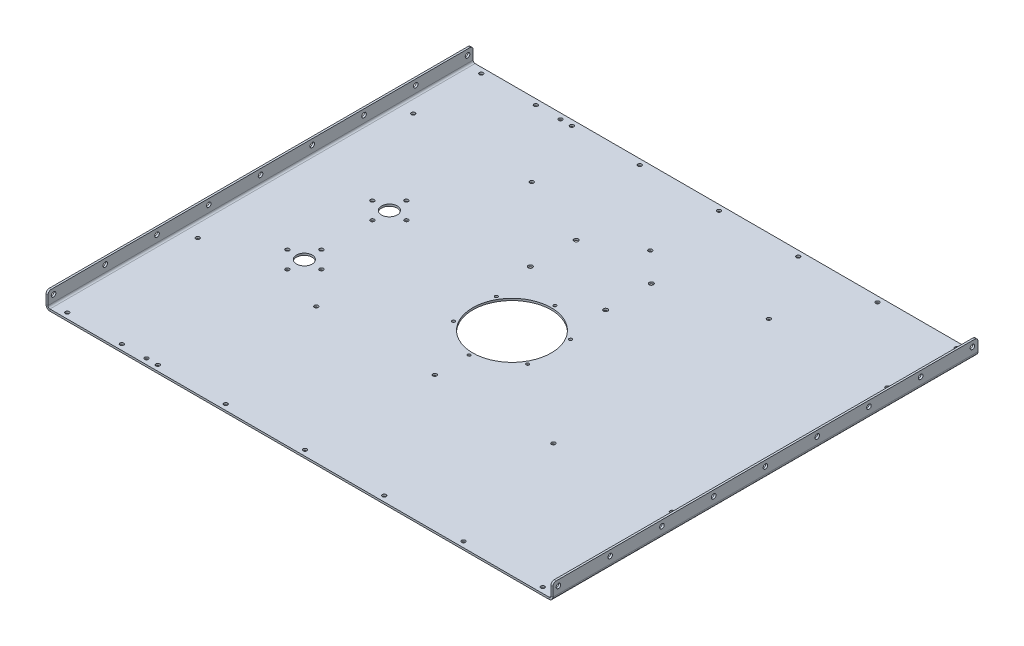
from build123d import *

# Parameters (mm, degrees)
BASE_FLANGE1_DEPTH       = 325
F_7_0_7_DIAMETER_HOLE1_D = 7
M5_CLEARANCE_HOLE1_D     = 5.8
SKETCH6_R                = 60
CUT_EXTRUDE1_DEPTH       = 3
M4_CLEARANCE_HOLE1_D     = 4.5
M6_CLEARANCE_HOLE1_D     = 6.6
M5_CLEARANCE_HOLE4_D     = 5.8
SKETCH13_R               = 12
CUT_EXTRUDE2_DEPTH       = 3
M5_CLEARANCE_HOLE2_D     = 5.8
M5_CLEARANCE_HOLE3_D     = 5.8
FILLET1_R                = 5


# Sheet-metal steps are written as plain solids
with BuildPart() as part:
    # Base-Flange1: sheet metal written as solids
    # Sketch1 → Base-Flange1 (new, symmetric)
    with BuildSketch(Plane.XY):
        with BuildLine():
            Line((-387.5, 25), (-387.5, 6))
            ThreePointArc((-387.5, 6), (-385.742640687, 1.757359313), (-381.5, 0))
            Line((-381.5, 0), (381.5, 0))
            ThreePointArc((381.5, 0), (385.742640687, 1.757359313), (387.5, 6))
            Line((387.5, 6), (387.5, 25))
            Line((387.5, 25), (384.5, 25))
            Line((384.5, 25), (384.5, 6))
            ThreePointArc((384.5, 6), (383.621320344, 3.878679656), (381.5, 3))
            Line((381.5, 3), (-381.5, 3))
            ThreePointArc((-381.5, 3), (-383.621320344, 3.878679656), (-384.5, 6))
            Line((-384.5, 6), (-384.5, 25))
            Line((-384.5, 25), (-387.5, 25))
        make_face()
    extrude(amount=BASE_FLANGE1_DEPTH, both=True)

    # Ø7.0 (7) Diameter Hole1 (through all)
    with Locations(Plane(origin=(387.5, 0, 0), x_dir=(0, 0, -1), z_dir=(1, 0, 0))):
        with Locations((-316.5, 16.5), (-237.375, 16.5), (-158.25, 16.5), (-79.125, 16.5), (0, 16.5), (79.125, 16.5), (158.25, 16.5), (237.375, 16.5), (316.5, 16.5)):
            Hole(F_7_0_7_DIAMETER_HOLE1_D / 2)

    # M5 Clearance Hole1 (through all)
    with Locations(Plane(origin=(0, 0, 0), x_dir=(-1, 0, 0), z_dir=(0, -1, 0))):
        with Locations((-363.5, 316.5), (-242.333333333, 316.5), (-121.166666667, 316.5), (0, 316.5), (121.166666667, 316.5), (242.333333333, 316.5), (363.5, 316.5)):
            m5_clearance_hole1 = Hole(M5_CLEARANCE_HOLE1_D / 2)

    # Mirror1: M5 Clearance Hole1 across plane
    add(m5_clearance_hole1.mirror(Plane.XY), mode=Mode.SUBTRACT)

    # Sketch6 → Cut-Extrude1 (cut)
    with BuildSketch(Plane(origin=(0, 3, 0), x_dir=(1, 0, 0), z_dir=(0, 1, 0))):
        with Locations(Location((0, 0, 0), (0, 0, 270))):
            Circle(SKETCH6_R)
    extrude(amount=-CUT_EXTRUDE1_DEPTH, mode=Mode.SUBTRACT)

    # M4 Clearance Hole1 (through all)
    with Locations(Plane(origin=(0, 3, 0), x_dir=(1, 0, 0), z_dir=(0, 1, 0))):
        with Locations((0, -65.5), (-56.724663948, -32.75), (-56.724663948, 32.75), (0, 65.5), (56.724663948, 32.75), (56.724663948, -32.75)):
            Hole(M4_CLEARANCE_HOLE1_D / 2)

    # M6 Clearance Hole1 (through all)
    with Locations(Plane(origin=(0, 3, 0), x_dir=(1, 0, 0), z_dir=(0, 1, 0))):
        with Locations((-70.35, 168.5), (44.65, 168.5), (-70.35, 98.5), (44.65, 98.5)):
            Hole(M6_CLEARANCE_HOLE1_D / 2)

    # M5 Clearance Hole4 (through all)
    with Locations(Plane(origin=(0, 3, 0), x_dir=(1, 0, 0), z_dir=(0, 1, 0))):
        with Locations((-362.5, 211.5), (-181.25, 211.5), (0, 211.5), (181.25, 211.5), (362.5, 211.5), (181.25, -118), (362.5, -118), (0, -118), (-181.25, -118), (-362.5, -118)):
            Hole(M5_CLEARANCE_HOLE4_D / 2)

    # Sketch13 → Cut-Extrude2 (cut)
    with BuildSketch(Plane(origin=(0, 3, 0), x_dir=(1, 0, 0), z_dir=(0, 1, 0))):
        with Locations(Location((-252.5, 65, 0), (0, 0, 270))):
            Circle(SKETCH13_R)
        with Locations(Location((-252.5, -65, 0), (0, 0, 270))):
            Circle(SKETCH13_R)
    extrude(amount=-CUT_EXTRUDE2_DEPTH, mode=Mode.SUBTRACT)

    # M5 Clearance Hole2 (through all)
    with Locations(Plane(origin=(0, 3, 0), x_dir=(1, 0, 0), z_dir=(0, 1, 0))):
        with Locations((-278.5, 65), (-252.5, 91), (-252.5, 39), (-226.5, 65), (-278.5, -65), (-226.5, -65), (-252.5, -91), (-252.5, -39)):
            Hole(M5_CLEARANCE_HOLE2_D / 2)

    # M5 Clearance Hole3 (through all)
    with Locations(Plane(origin=(0, 3, 0), x_dir=(1, 0, 0), z_dir=(0, 1, 0))):
        with Locations((-280, 316.5), (-225, 316.5), (-280, -316.5), (-225, -316.5)):
            Hole(M5_CLEARANCE_HOLE3_D / 2)

    # Fillet1
    fillet1_edges = [part.edges().sort_by_distance(p)[0] for p in [
        (-386, 25, -325),
        (386, 25, -325),
        (-386, 25, 325),
        (386, 25, 325),
    ]]
    fillet(fillet1_edges, radius=FILLET1_R)


solid = part.part
